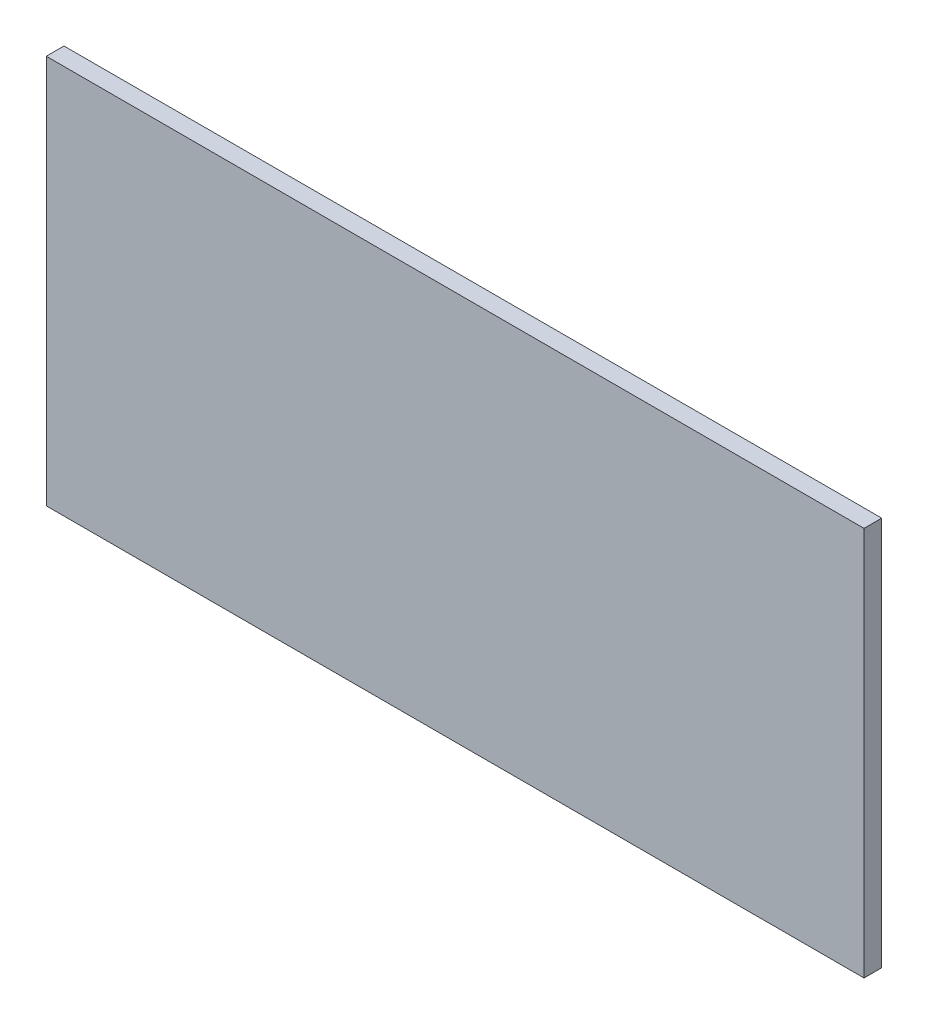
from build123d import *

# Parameters (mm, degrees)
SKETCH1_W           = 231
SKETCH1_H           = 110
BOSS_EXTRUDE1_DEPTH = 5


with BuildPart() as part:
    # Sketch1 → Boss-Extrude1 (new body)
    with BuildSketch(Plane.XY):
        Rectangle(SKETCH1_W, SKETCH1_H)
    extrude(amount=BOSS_EXTRUDE1_DEPTH)


solid = part.part
